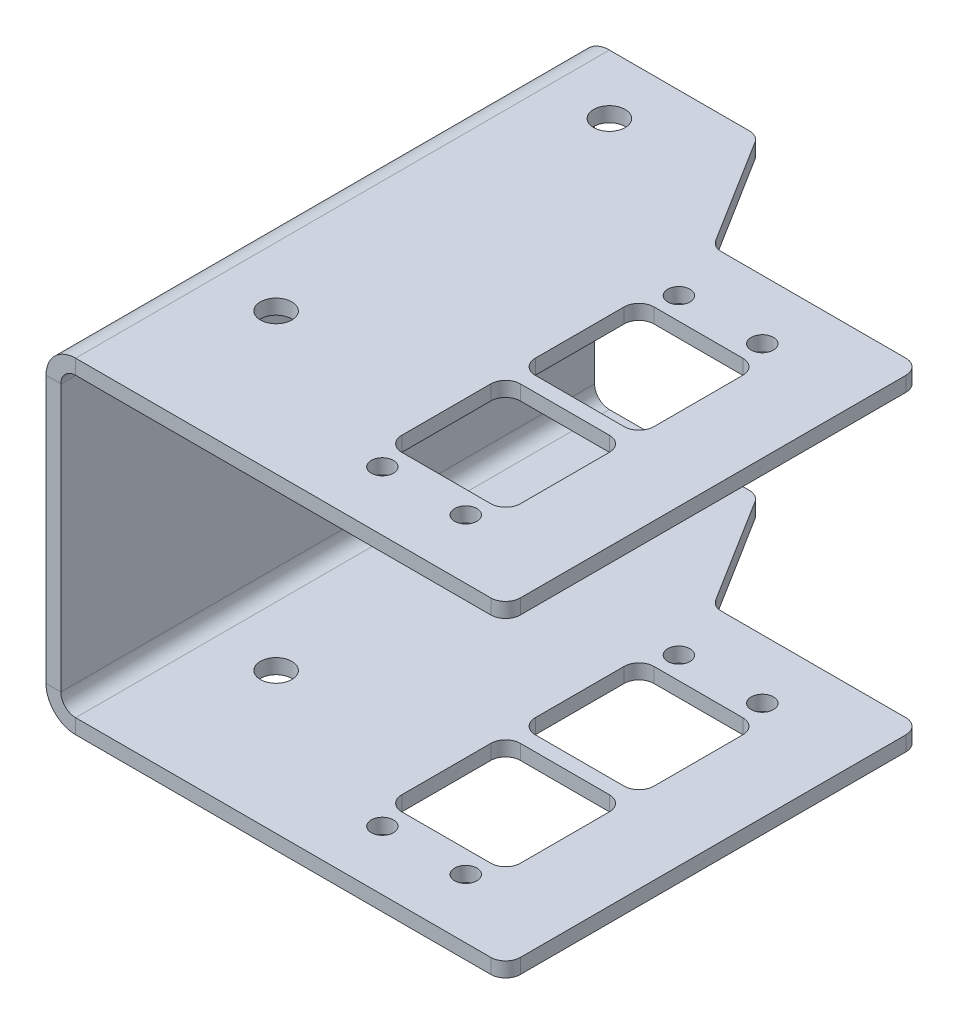
from build123d import *

# Parameters (mm, degrees)
SKETCH1_W                      = 114.3
SKETCH1_H                      = 69.85
BASE_FLANGE1_DEPTH             = 3.175
EDGE_FLANGE1_STRIP_W           = 19.05
EDGE_FLANGE1_STRIP_H           = 3.175
EDGE_FLANGE1_STRIP_CUT_DEPTH   = 114.3
EDGE_FLANGE1_STRIP_2_W         = 19.05
EDGE_FLANGE1_STRIP_2_H         = 3.175
EDGE_FLANGE1_STRIP_CUT_2_DEPTH = 114.3
EDGE_FLANGE1_DEPTH             = 114.3
EDGE_FLANGE1_BEND_DEPTH        = 114.3
SKETCH12_R                     = 2.38125
SKETCH12_R_2                   = 3.3734375
CUT_EXTRUDE1_DEPTH             = 165.36567464
FILLET1_R                      = 3.175


# Sheet-metal steps are written as plain solids
with BuildPart() as part:
    # Sketch1 → Base-Flange1 (new body)
    with BuildSketch(Plane(origin=(0, 0, 0), x_dir=(0, 0, -1), z_dir=(1, 0, 0))):
        with Locations((57.15, 34.925)):
            Rectangle(SKETCH1_W, SKETCH1_H)
    extrude(amount=-BASE_FLANGE1_DEPTH)

    # Edge-Flange1 strip (across the edge) → Edge-Flange1 strip cut (cut)
    with BuildSketch(Plane(origin=(0, 69.85, -114.3), x_dir=(0, -1, 0), z_dir=(0, 0, 1))):
        with Locations((-3.175, -1.5875)):
            Rectangle(EDGE_FLANGE1_STRIP_W, EDGE_FLANGE1_STRIP_H)
    extrude(amount=EDGE_FLANGE1_STRIP_CUT_DEPTH, mode=Mode.SUBTRACT)

    # Edge-Flange1 strip 2 (across the edge) → Edge-Flange1 strip cut 2 (cut)
    with BuildSketch(Plane.YX):
        with Locations((-3.175, -1.5875)):
            Rectangle(EDGE_FLANGE1_STRIP_2_W, EDGE_FLANGE1_STRIP_2_H)
    extrude(amount=EDGE_FLANGE1_STRIP_CUT_2_DEPTH, mode=Mode.SUBTRACT)

    # Edge-Flange1 section (across the edge) → Edge-Flange1 (add)
    with BuildSketch(Plane(origin=(0, 69.85, -114.3), x_dir=(0, -1, 0), z_dir=(0, 0, 1))):
        with BuildLine():
            Line((0, 3.175), (0, 95.25))
            Line((0, 95.25), (3.175, 95.25))
            Line((3.175, 95.25), (3.175, 3.175))
            ThreePointArc((3.175, 3.175), (4.10493597, 0.92993597), (6.35, 0))
            Line((6.35, 0), (6.35, -3.175))
            ThreePointArc((6.35, -3.175), (1.859871939, -1.315128061), (0, 3.175))
        make_face()
    extrude(amount=EDGE_FLANGE1_DEPTH)

    # Edge-Flange1 section 2 (across the edge) → Edge-Flange1 bend (add)
    with BuildSketch(Plane.YX):
        with BuildLine():
            Line((0, 3.175), (0, 95.25))
            Line((0, 95.25), (3.175, 95.25))
            Line((3.175, 95.25), (3.175, 3.175))
            ThreePointArc((3.175, 3.175), (4.10493597, 0.92993597), (6.35, 0))
            Line((6.35, 0), (6.35, -3.175))
            ThreePointArc((6.35, -3.175), (1.859871939, -1.315128061), (0, 3.175))
        make_face()
    extrude(amount=EDGE_FLANGE1_BEND_DEPTH)

    # Sketch12 → Cut-Extrude1 (cut, through all)
    with BuildSketch(Plane(origin=(0, 69.85, 0), x_dir=(1, 0, 0), z_dir=(0, 1, 0))):
        with Locations(Location((56.1594, 76.2, 0), (0, 0, 180))):
            Circle(SKETCH12_R)
        with Locations(Location((74.01814, 76.2, 0), (0, 0, 180))):
            Circle(SKETCH12_R)
        with Locations(Location((56.1594, 12.7, 0), (0, 0, 180))):
            Circle(SKETCH12_R)
        with Locations(Location((74.01814, 12.7, 0), (0, 0, 180))):
            Circle(SKETCH12_R)
        with Locations(Location((15.875, 101.6, 0), (0, 0, 180))):
            Circle(SKETCH12_R_2)
        with Locations(Location((15.875, 30.226, 0), (0, 0, 180))):
            Circle(SKETCH12_R_2)
        Polygon((34.925, 114.3), (50.8, 88.9), (95.25, 88.9), (95.25, 114.3), align=None)
        with BuildLine():
            Line((55.5625, 71.4375), (74.6125, 71.4375))
            ThreePointArc((74.6125, 71.4375), (76.85756403, 70.50756403), (77.7875, 68.2625))
            Line((77.7875, 68.2625), (77.7875, 49.2125))
            ThreePointArc((77.7875, 49.2125), (76.85756403, 46.96743597), (74.6125, 46.0375))
            Line((74.6125, 46.0375), (55.5625, 46.0375))
            ThreePointArc((55.5625, 46.0375), (53.31743597, 46.96743597), (52.3875, 49.2125))
            Line((52.3875, 49.2125), (52.3875, 68.2625))
            ThreePointArc((52.3875, 68.2625), (53.31743597, 70.50756403), (55.5625, 71.4375))
        make_face()
        with BuildLine():
            Line((74.6125, 42.8625), (55.5625, 42.8625))
            ThreePointArc((55.5625, 42.8625), (53.31743597, 41.93256403), (52.3875, 39.6875))
            Line((52.3875, 39.6875), (52.3875, 20.6375))
            ThreePointArc((52.3875, 20.6375), (53.31743597, 18.39243597), (55.5625, 17.4625))
            Line((55.5625, 17.4625), (74.6125, 17.4625))
            ThreePointArc((74.6125, 17.4625), (76.85756403, 18.39243597), (77.7875, 20.6375))
            Line((77.7875, 20.6375), (77.7875, 39.6875))
            ThreePointArc((77.7875, 39.6875), (76.85756403, 41.93256403), (74.6125, 42.8625))
        make_face()
    extrude(amount=-CUT_EXTRUDE1_DEPTH, mode=Mode.SUBTRACT)

    # Fillet1
    fillet1_edges = [part.edges().sort_by_distance(p)[0] for p in [
        (50.8, 68.2625, -88.9),
        (34.925, 68.2625, -114.3),
        (95.25, 68.2625, -88.9),
        (34.925, 1.5875, -114.3),
        (95.25, 1.5875, -88.9),
        (50.8, 1.5875, -88.9),
        (95.25, 68.2625, 0),
        (95.25, 1.5875, 0),
    ]]
    fillet(fillet1_edges, radius=FILLET1_R)


solid = part.part
